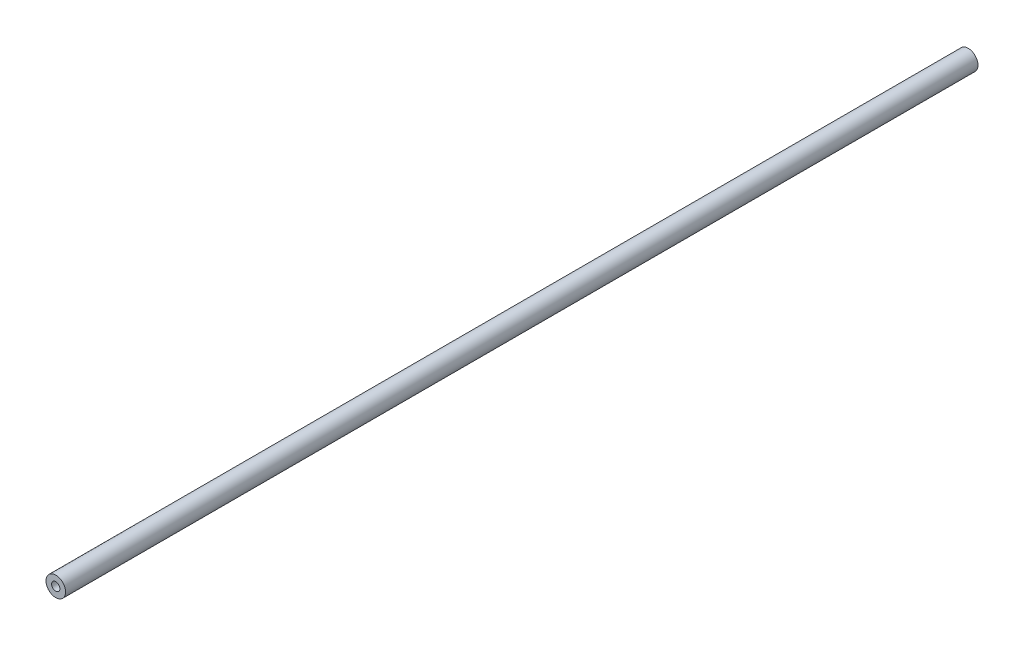
from build123d import *

# Parameters (mm, degrees)
SKETCH1_R                            = 4.7625
BOSS_EXTRUDE1_DEPTH                  = 444.5
F_10_32_TAPPED_HOLE1_D               = 4.0386
F_10_32_TAPPED_HOLE1_DEPTH           = 15.07744
F_10_32_TAPPED_HOLE1_TIP             = 1.213317848
F_10_32_TAPPED_HOLE1_ON_FACE_2_D     = 4.0386
F_10_32_TAPPED_HOLE1_ON_FACE_2_DEPTH = 15.07744
F_10_32_TAPPED_HOLE1_ON_FACE_2_TIP   = 1.213317848


with BuildPart() as part:
    # Sketch1 → Boss-Extrude1 (new body)
    with BuildSketch(Plane.XY):
        Circle(SKETCH1_R)
    extrude(amount=BOSS_EXTRUDE1_DEPTH)

    # #10-32 Tapped Hole1
    with Locations(Plane.XY.offset(444.5)):
        with Locations((0, 0)):
            Hole(F_10_32_TAPPED_HOLE1_D / 2, depth=F_10_32_TAPPED_HOLE1_DEPTH)
            with Locations((0, 0, -(F_10_32_TAPPED_HOLE1_DEPTH + F_10_32_TAPPED_HOLE1_TIP / 2))):  # 118° drill point
                Cone(0, F_10_32_TAPPED_HOLE1_D / 2, F_10_32_TAPPED_HOLE1_TIP, mode=Mode.SUBTRACT)

    # #10-32 Tapped Hole1 on face 2
    with Locations(Plane(origin=(0, 0, 0), x_dir=(-1, 0, 0), z_dir=(0, 0, -1))):
        with Locations((0, 0)):
            Hole(F_10_32_TAPPED_HOLE1_ON_FACE_2_D / 2, depth=F_10_32_TAPPED_HOLE1_ON_FACE_2_DEPTH)
            with Locations((0, 0, -(F_10_32_TAPPED_HOLE1_ON_FACE_2_DEPTH + F_10_32_TAPPED_HOLE1_ON_FACE_2_TIP / 2))):  # 118° drill point
                Cone(0, F_10_32_TAPPED_HOLE1_ON_FACE_2_D / 2, F_10_32_TAPPED_HOLE1_ON_FACE_2_TIP, mode=Mode.SUBTRACT)


solid = part.part
